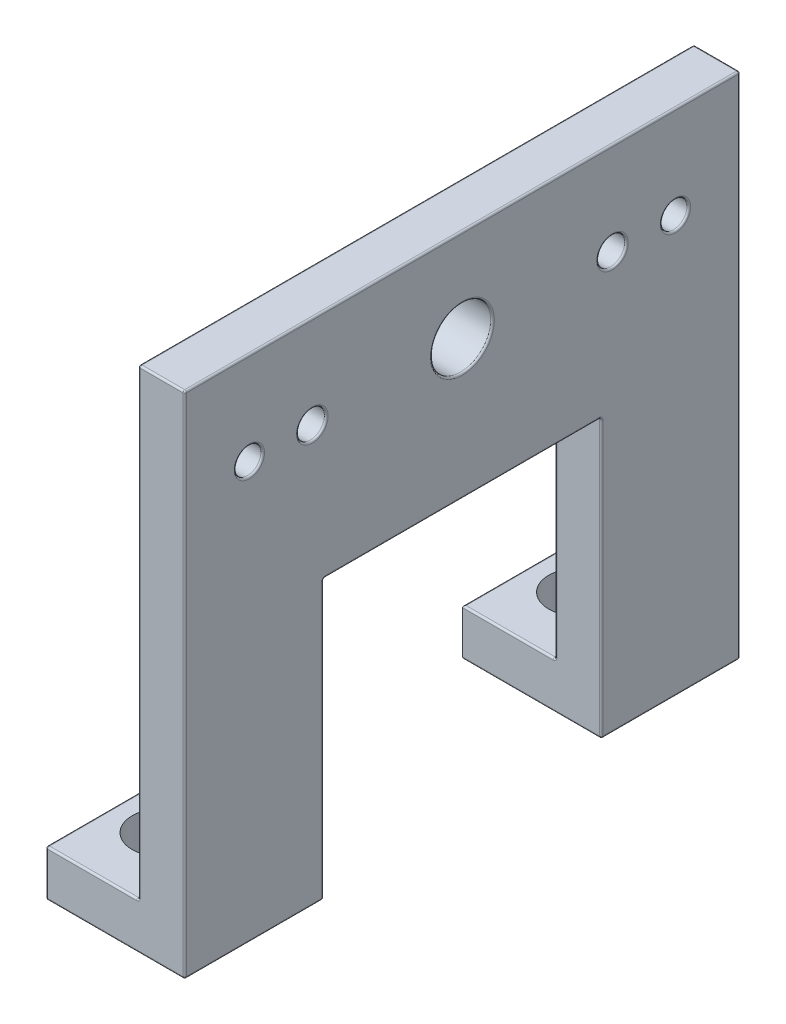
from build123d import *

# Parameters (mm, degrees)
BOSS_EXTRUDE1_DEPTH = 60
SKETCH2_R           = 3.25
SKETCH2_R_2         = 1.435
SKETCH2_R_3         = 1.5
CUT_EXTRUDE1_DEPTH  = 83.764726786
CUT_EXTRUDE2_START  = -15
CUT_EXTRUDE2_DEPTH  = 30
FILLET16_R          = 0.2
SKETCH4_R           = 3.175
CUT_EXTRUDE3_DEPTH  = 80.529868603


with BuildPart() as part:
    # Sketch1 → Boss-Extrude1 (new body)
    with BuildSketch(Plane.XY):
        Polygon((0, 0), (15, 0), (15, 5), (15, 55), (10, 55), (10, 5), (0, 5), align=None)
    extrude(amount=BOSS_EXTRUDE1_DEPTH)

    # Sketch2 → Cut-Extrude1 (cut, through all)
    with BuildSketch(Plane(origin=(15, 0, 0), x_dir=(0, 0, -1), z_dir=(1, 0, 0))):
        with Locations((-30, 45)):
            Circle(SKETCH2_R)
        with Locations((-6.9875, 45)):
            Circle(SKETCH2_R_2)
        with Locations((-13.785, 45)):
            Circle(SKETCH2_R_3)
        with Locations((-46.215, 45)):
            Circle(SKETCH2_R_3)
        with Locations((-53.0125, 45)):
            Circle(SKETCH2_R_2)
    extrude(amount=-CUT_EXTRUDE1_DEPTH, mode=Mode.SUBTRACT)

    # Sketch3 → Cut-Extrude2 (cut)
    with BuildSketch(Plane(origin=(0, 0, 0), x_dir=(-1, 0, 0), z_dir=(0, 0, -1)).offset(CUT_EXTRUDE2_START)):
        Polygon((-15, 30), (-10, 30), (-10, 5), (0, 5), (0, 0), (-15, 0), align=None)
    extrude(amount=-CUT_EXTRUDE2_DEPTH, mode=Mode.SUBTRACT)

    # Fillet16
    fillet16_edges = [part.edges().sort_by_distance(p)[0] for p in [
        (5, 5, 15),
        (0, 5, 7.5),
        (0, 5, 52.5),
        (5, 5, 45),
        (12.5, 30, 45),
        (12.5, 30, 15),
        (0, 0, 52.5),
        (7.5, 0, 45),
        (0, 0, 7.5),
        (7.5, 0, 15),
        (5, 5, 60),
        (12.5, 55, 60),
        (7.5, 0, 60),
        (0, 2.5, 60),
        (7.5, 0, 0),
        (12.5, 55, 0),
        (5, 5, 0),
        (0, 2.5, 0),
        (15, 0, 52.5),
        (15, 27.5, 60),
        (15, 55, 30),
        (15, 27.5, 0),
        (15, 0, 7.5),
        (15, 15, 15),
        (15, 30, 30),
        (15, 15, 45),
        (15, 45, 54.4475),
        (15, 45, 47.715),
        (15, 45, 15.285),
        (15, 45, 8.4225),
        (15, 45, 33.25),
        (10, 30, 30),
        (10, 17.5, 15),
        (10, 5, 7.5),
        (10, 30, 0),
        (10, 55, 30),
        (10, 30, 60),
        (10, 5, 52.5),
        (10, 17.5, 45),
        (10, 45, 54.4475),
        (10, 45, 47.715),
        (10, 45, 15.285),
        (10, 45, 8.4225),
        (10, 45, 33.25),
    ]]
    fillet(fillet16_edges, radius=FILLET16_R)

    # Sketch4 → Cut-Extrude3 (cut, through all)
    with BuildSketch(Plane(origin=(0, 5, 0), x_dir=(1, 0, 0), z_dir=(0, 1, 0))):
        with Locations((5, -7.5)):
            Circle(SKETCH4_R)
        with Locations((5, -52.5)):
            Circle(SKETCH4_R)
    extrude(amount=-CUT_EXTRUDE3_DEPTH, mode=Mode.SUBTRACT)


solid = part.part
